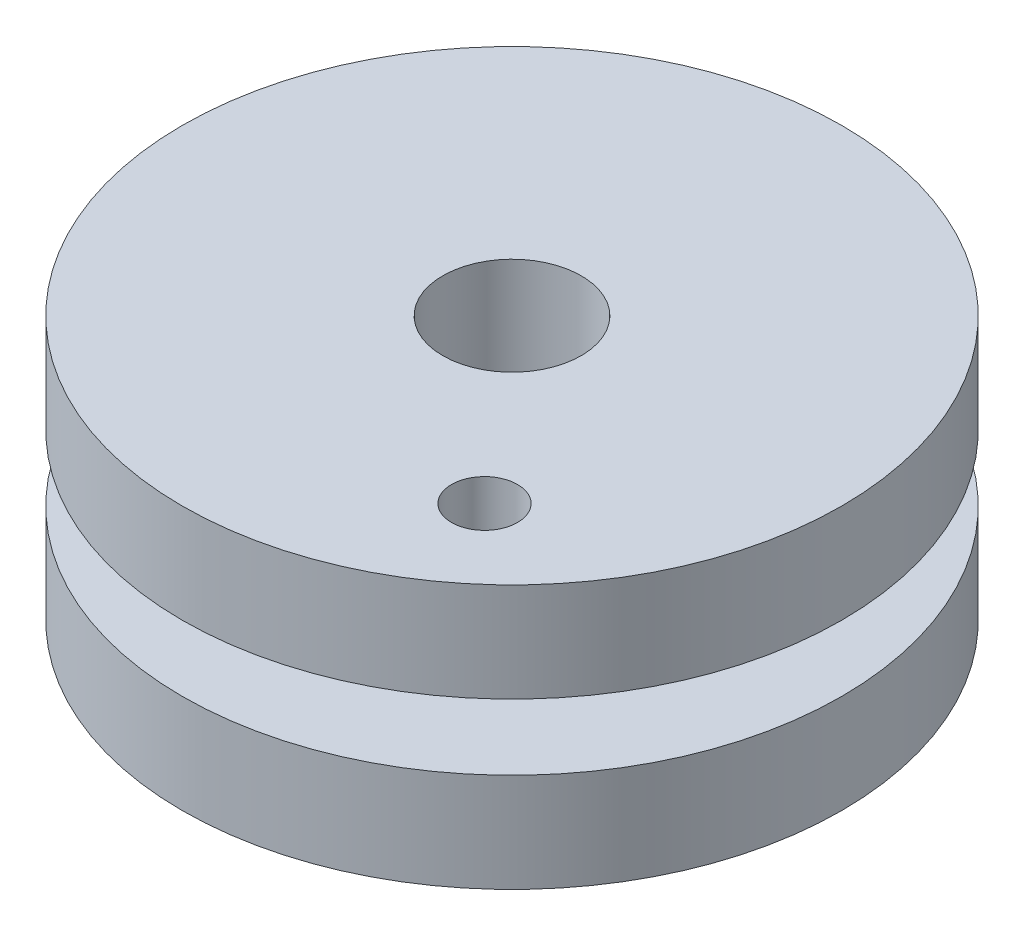
from build123d import *

# Parameters (mm, degrees)
SKETCH_1_R          = 10
SKETCH_1_R_2        = 2.1
EXTRUDE_1_DEPTH     = 8
CUT_EXTRUDE_START   = -3
SKETCH_2_R          = 10
SKETCH_2_R_2        = 5
CUT_EXTRUDE_1_DEPTH = 2
FILLET_1_R          = 1
CUT_EXTRUDE_2_REACH = 18.248
SKETCH_3_R          = 1


with BuildPart() as part:
    # 草图1 → 凸台-拉伸1 (new body)
    with BuildSketch(Plane(origin=(0, 0, 0), x_dir=(1, 0, 0), z_dir=(0, 1, 0))):
        with Locations(Location((0, 0, 0), (0, 0, 270))):
            Circle(SKETCH_1_R)
        with Locations(Location((0, 0, 0), (0, 0, 270))):
            Circle(SKETCH_1_R_2, mode=Mode.SUBTRACT)
    extrude(amount=EXTRUDE_1_DEPTH)

    # 草图2 → 切除-拉伸1 (cut)
    with BuildSketch(Plane.XZ.offset(CUT_EXTRUDE_START)):
        with Locations(Location((0, 0, 0), (0, 0, 270))):
            Circle(SKETCH_2_R)
        with Locations(Location((0, 0, 0), (0, 0, 270))):
            Circle(SKETCH_2_R_2, mode=Mode.SUBTRACT)
    extrude(amount=-CUT_EXTRUDE_1_DEPTH, mode=Mode.SUBTRACT)

    # 圆角1
    fillet_1_edges = [part.edges().sort_by_distance(p)[0] for p in [
        (0, 5, 5),
        (0, 3, 5),
    ]]
    fillet(fillet_1_edges, radius=FILLET_1_R - 0.0001)  # a hair under: the kernel refuses the full size

    # 草图3 → 切除-拉伸2 (cut, up to next)
    with BuildSketch(Plane(origin=(0, 8, 0), x_dir=(1, 0, 0), z_dir=(0, 1, 0)), mode=Mode.PRIVATE) as cut_extrude_2_sk1:
        with Locations(Location((4.515189348, -5.349118166, 0), (0, 0, 270))):
            Circle(SKETCH_3_R)
    cut_extrude_2_tool1 = extrude(cut_extrude_2_sk1.sketch, amount=-CUT_EXTRUDE_2_REACH, mode=Mode.PRIVATE) & part.part
    add(cut_extrude_2_tool1.solids().sort_by_distance((4.515189, 8, 5.349118))[0], mode=Mode.SUBTRACT)


solid = part.part
